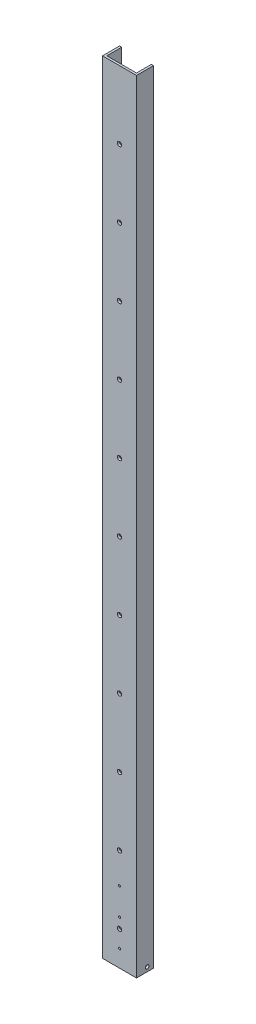
from build123d import *

# Parameters (mm, degrees)
BOSS_EXTRUDE1_DEPTH = 1168.4
CUT_EXTRUDE1_REACH  = 1171.78
SKETCH2_R           = 3.175
CUT_EXTRUDE2_REACH  = 1171.715
SKETCH3_R           = 1.5875
SKETCH4_R           = 2.667
CUT_EXTRUDE3_DEPTH  = 1170.77962027


with BuildPart() as part:
    # Sketch1 → Boss-Extrude1 (new body)
    with BuildSketch(Plane(origin=(0, 0, 0), x_dir=(1, 0, 0), z_dir=(0, 1, 0))):
        Polygon((3.175, 3.175), (3.175, 25.4), (0, 25.4), (0, 0), (50.8, 0), (50.8, 25.4), (47.625, 25.4), (47.625, 3.175), align=None)
    extrude(amount=BOSS_EXTRUDE1_DEPTH)

    # Sketch2 → Cut-Extrude1 (cut, up to next)
    with BuildSketch(Plane.XY, mode=Mode.PRIVATE) as cut_extrude1_sk1:
        with Locations((25.4, 50.8)):
            Circle(SKETCH2_R)
    cut_extrude1_tool1 = extrude(cut_extrude1_sk1.sketch, amount=-CUT_EXTRUDE1_REACH, mode=Mode.PRIVATE) & part.part
    # Sketch2 → Cut-Extrude1 (cut, up to next)
    with BuildSketch(Plane.XY, mode=Mode.PRIVATE) as cut_extrude1_sk2:
        with Locations((25.4, 152.4)):
            Circle(SKETCH2_R)
    cut_extrude1_tool2 = extrude(cut_extrude1_sk2.sketch, amount=-CUT_EXTRUDE1_REACH, mode=Mode.PRIVATE) & part.part
    # Sketch2 → Cut-Extrude1 (cut, up to next)
    with BuildSketch(Plane.XY, mode=Mode.PRIVATE) as cut_extrude1_sk3:
        with Locations((25.4, 254)):
            Circle(SKETCH2_R)
    cut_extrude1_tool3 = extrude(cut_extrude1_sk3.sketch, amount=-CUT_EXTRUDE1_REACH, mode=Mode.PRIVATE) & part.part
    # Sketch2 → Cut-Extrude1 (cut, up to next)
    with BuildSketch(Plane.XY, mode=Mode.PRIVATE) as cut_extrude1_sk4:
        with Locations((25.4, 355.6)):
            Circle(SKETCH2_R)
    cut_extrude1_tool4 = extrude(cut_extrude1_sk4.sketch, amount=-CUT_EXTRUDE1_REACH, mode=Mode.PRIVATE) & part.part
    # Sketch2 → Cut-Extrude1 (cut, up to next)
    with BuildSketch(Plane.XY, mode=Mode.PRIVATE) as cut_extrude1_sk5:
        with Locations((25.4, 457.2)):
            Circle(SKETCH2_R)
    cut_extrude1_tool5 = extrude(cut_extrude1_sk5.sketch, amount=-CUT_EXTRUDE1_REACH, mode=Mode.PRIVATE) & part.part
    # Sketch2 → Cut-Extrude1 (cut, up to next)
    with BuildSketch(Plane.XY, mode=Mode.PRIVATE) as cut_extrude1_sk6:
        with Locations((25.4, 558.8)):
            Circle(SKETCH2_R)
    cut_extrude1_tool6 = extrude(cut_extrude1_sk6.sketch, amount=-CUT_EXTRUDE1_REACH, mode=Mode.PRIVATE) & part.part
    # Sketch2 → Cut-Extrude1 (cut, up to next)
    with BuildSketch(Plane.XY, mode=Mode.PRIVATE) as cut_extrude1_sk7:
        with Locations((25.4, 660.4)):
            Circle(SKETCH2_R)
    cut_extrude1_tool7 = extrude(cut_extrude1_sk7.sketch, amount=-CUT_EXTRUDE1_REACH, mode=Mode.PRIVATE) & part.part
    # Sketch2 → Cut-Extrude1 (cut, up to next)
    with BuildSketch(Plane.XY, mode=Mode.PRIVATE) as cut_extrude1_sk8:
        with Locations((25.4, 762)):
            Circle(SKETCH2_R)
    cut_extrude1_tool8 = extrude(cut_extrude1_sk8.sketch, amount=-CUT_EXTRUDE1_REACH, mode=Mode.PRIVATE) & part.part
    # Sketch2 → Cut-Extrude1 (cut, up to next)
    with BuildSketch(Plane.XY, mode=Mode.PRIVATE) as cut_extrude1_sk9:
        with Locations((25.4, 863.6)):
            Circle(SKETCH2_R)
    cut_extrude1_tool9 = extrude(cut_extrude1_sk9.sketch, amount=-CUT_EXTRUDE1_REACH, mode=Mode.PRIVATE) & part.part
    # Sketch2 → Cut-Extrude1 (cut, up to next)
    with BuildSketch(Plane.XY, mode=Mode.PRIVATE) as cut_extrude1_sk10:
        with Locations((25.4, 965.2)):
            Circle(SKETCH2_R)
    cut_extrude1_tool10 = extrude(cut_extrude1_sk10.sketch, amount=-CUT_EXTRUDE1_REACH, mode=Mode.PRIVATE) & part.part
    # Sketch2 → Cut-Extrude1 (cut, up to next)
    with BuildSketch(Plane.XY, mode=Mode.PRIVATE) as cut_extrude1_sk11:
        with Locations((25.4, 1066.8)):
            Circle(SKETCH2_R)
    cut_extrude1_tool11 = extrude(cut_extrude1_sk11.sketch, amount=-CUT_EXTRUDE1_REACH, mode=Mode.PRIVATE) & part.part
    add(cut_extrude1_tool1.solids().sort_by_distance((25.4, 50.8, 0))[0], mode=Mode.SUBTRACT)
    add(cut_extrude1_tool2.solids().sort_by_distance((25.4, 152.4, 0))[0], mode=Mode.SUBTRACT)
    add(cut_extrude1_tool3.solids().sort_by_distance((25.4, 254, 0))[0], mode=Mode.SUBTRACT)
    add(cut_extrude1_tool4.solids().sort_by_distance((25.4, 355.6, 0))[0], mode=Mode.SUBTRACT)
    add(cut_extrude1_tool5.solids().sort_by_distance((25.4, 457.2, 0))[0], mode=Mode.SUBTRACT)
    add(cut_extrude1_tool6.solids().sort_by_distance((25.4, 558.8, 0))[0], mode=Mode.SUBTRACT)
    add(cut_extrude1_tool7.solids().sort_by_distance((25.4, 660.4, 0))[0], mode=Mode.SUBTRACT)
    add(cut_extrude1_tool8.solids().sort_by_distance((25.4, 762, 0))[0], mode=Mode.SUBTRACT)
    add(cut_extrude1_tool9.solids().sort_by_distance((25.4, 863.6, 0))[0], mode=Mode.SUBTRACT)
    add(cut_extrude1_tool10.solids().sort_by_distance((25.4, 965.2, 0))[0], mode=Mode.SUBTRACT)
    add(cut_extrude1_tool11.solids().sort_by_distance((25.4, 1066.8, 0))[0], mode=Mode.SUBTRACT)

    # Sketch3 → Cut-Extrude2 (cut, up to next)
    with BuildSketch(Plane(origin=(0, 0, -3.175), x_dir=(-1, 0, 0), z_dir=(0, 0, -1)), mode=Mode.PRIVATE) as cut_extrude2_sk1:
        with Locations((-25.4, 25.4)):
            Circle(SKETCH3_R)
    cut_extrude2_tool1 = extrude(cut_extrude2_sk1.sketch, amount=-CUT_EXTRUDE2_REACH, mode=Mode.PRIVATE) & part.part
    # Sketch3 → Cut-Extrude2 (cut, up to next)
    with BuildSketch(Plane(origin=(0, 0, -3.175), x_dir=(-1, 0, 0), z_dir=(0, 0, -1)), mode=Mode.PRIVATE) as cut_extrude2_sk2:
        with Locations((-25.4, 66.020295879)):
            Circle(SKETCH3_R)
    cut_extrude2_tool2 = extrude(cut_extrude2_sk2.sketch, amount=-CUT_EXTRUDE2_REACH, mode=Mode.PRIVATE) & part.part
    # Sketch3 → Cut-Extrude2 (cut, up to next)
    with BuildSketch(Plane(origin=(0, 0, -3.175), x_dir=(-1, 0, 0), z_dir=(0, 0, -1)), mode=Mode.PRIVATE) as cut_extrude2_sk3:
        with Locations((-25.4, 106.640591758)):
            Circle(SKETCH3_R)
    cut_extrude2_tool3 = extrude(cut_extrude2_sk3.sketch, amount=-CUT_EXTRUDE2_REACH, mode=Mode.PRIVATE) & part.part
    add(cut_extrude2_tool1.solids().sort_by_distance((25.4, 25.4, -3.175))[0], mode=Mode.SUBTRACT)
    add(cut_extrude2_tool2.solids().sort_by_distance((25.4, 66.020296, -3.175))[0], mode=Mode.SUBTRACT)
    add(cut_extrude2_tool3.solids().sort_by_distance((25.4, 106.640592, -3.175))[0], mode=Mode.SUBTRACT)

    # Sketch4 → Cut-Extrude3 (cut, through all)
    with BuildSketch(Plane.ZY):
        with Locations((-15.875, 6.35)):
            Circle(SKETCH4_R)
    extrude(amount=-CUT_EXTRUDE3_DEPTH, mode=Mode.SUBTRACT)


solid = part.part
